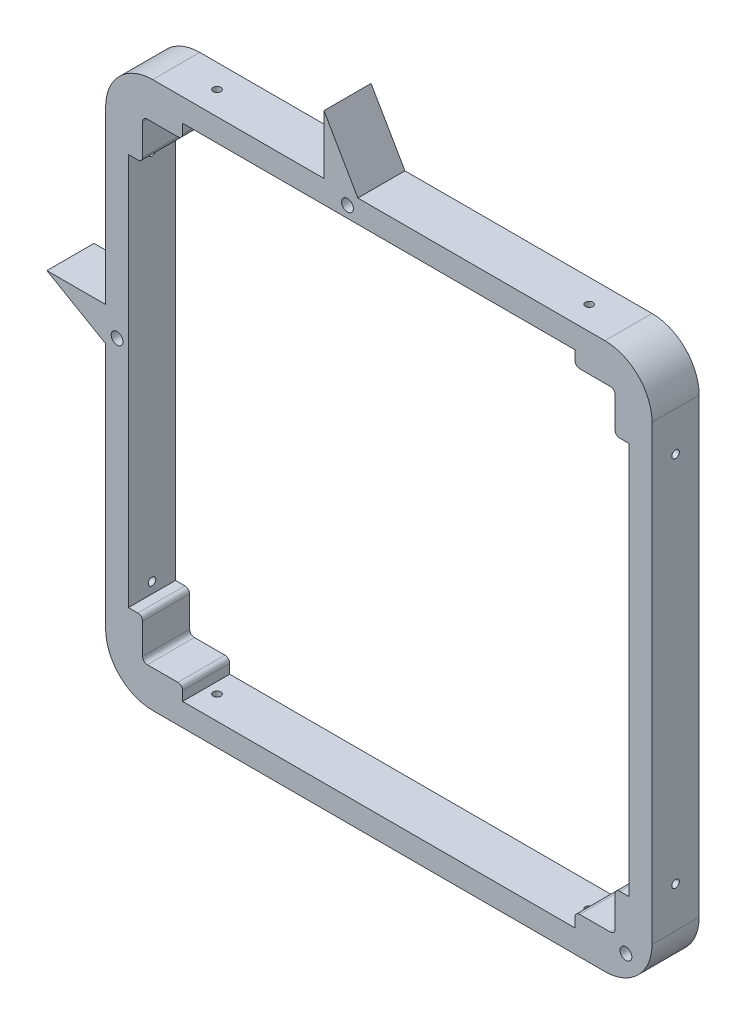
from build123d import *

# Parameters (mm, degrees)
BASE_DEPTH                       = 5
ARM_DEPTH                        = 5
CUT_EXTRUDE1_DEPTH               = 98.51535195125132
BOSS_EXTRUDE4_DEPTH              = 28
CLEARANCE_DEPTH                  = 20
M2X0_4_TAPPED_HOLE1_AT_2_COUNT   = 2
M2X0_4_TAPPED_HOLE1_AT_2_PITCH   = 79
M2X0_4_TAPPED_HOLE2_AT_2_COUNT   = 2
M2X0_4_TAPPED_HOLE2_AT_2_PITCH   = 79
EXTENDER_DEPTH                   = 29
ANGLED_HORIZONTAL_DEPTH          = 10
ARM_START                        = -5
ARM_HOLDER_DEPTH                 = 10
FILLET1_R                        = 1
FILLET2_R                        = 10
M3X0_5_TAPPED_HOLE2_D            = 2.5
BOSS_EXTRUDE18_REACH             = 170.267
SKETCH39_W                       = 4.000000000000028
SKETCH39_H                       = 10.000000000000007
BOSS_EXTRUDE18_DIRECTION_2_REACH = 170.267
SHIM_SUPPORT_ARM_DEPTH           = 6.85
BOSS_EXTRUDE17_REACH             = 169.03
FILLET4_R                        = 2
SPLIT1_START                     = -44
SPLIT1_OUTLINE_R                 = 1.25
SPLIT1_DEPTH                     = 39


# Read off the part's stored shape, not the designer's step: Split1
with BuildPart() as part:
    # Sketch1 → base (new, symmetric)
    with BuildSketch(Plane.XY):
        Polygon((58.00000000000011, 58.00000000000005), (58.00000000000011, -58.00000000000005), (-58.00000000000008, -58.00000000000009), (-58.00000000000008, 58.00000000000009), align=None)
        Polygon((-41.5, 53.00000000000001), (41.5, 53.00000000000001), (41.5, 50.00188016), (50.00188015999998, 50.00188015999996), (50.00188015999998, 41.49999999999998), (52.999999999999986, 41.49999999999998), (52.999999999999986, -41.49999999999998), (50.00188015999996, -41.499999999999964), (50.00188015999999, -50.001880160000006), (41.499999999999964, -50.00188015999996), (41.49999999999998, -52.99999999999998), (-41.5, -53.00000000000001), (-41.5, -50.00188016), (-50.00188015999999, -50.001880160000006), (-50.00188015999996, -41.499999999999964), (-52.999999999999986, -41.49999999999998), (-52.999999999999986, 41.49999999999998), (-50.00188015999998, 41.49999999999998), (-50.00188015999998, 50.00188015999996), (-41.5, 50.00188016), align=None, mode=Mode.SUBTRACT)
    extrude(amount=BASE_DEPTH, both=True)

    # Sketch2 → arm (add, symmetric)
    with BuildSketch(Plane(origin=(0, 0, 0), x_dir=(0.7071067811865476, -0.7071067811865475, 0), z_dir=(0.7071067811865475, 0.7071067811865476, 0))):
        Polygon((70.9254691007821, 5), (82.02438661763962, 5), (82.02438661763962, 44), (32.02438661763962, 43.999999999999986), (32.02438661763962, 33), (70.9254691007821, 33), align=None)
    extrude(amount=ARM_DEPTH, both=True)

    # Sketch3 → Cut-Extrude1 (cut, through all)
    with BuildSketch(Plane.XY):
        Polygon((54.81801948466061, -61.889087296526085), (61.88908729652609, -54.81801948466061), (58.00000000000011, -50.928932188134624), (58.0000000000001, -58.00000000000005), (50.92893218813458, -58.00000000000006), align=None)
    extrude(amount=-CUT_EXTRUDE1_DEPTH, mode=Mode.SUBTRACT)

    # Sketch5 → Boss-Extrude4 (add)
    with BuildSketch(Plane(origin=(0, 0, -5), x_dir=(-1, 0, 0), z_dir=(0, 0, -1))):
        Polygon((-50.15188015999995, -50.151880159999976), (-46.61634625406723, -53.68741406593269), (-43.080812348134494, -50.15188015999998), align=None)
        Polygon((-53.68741406593271, -46.61634625406722), (-50.15188015999995, -50.151880159999976), (-50.15188015999996, -43.08081234813448), align=None)
    extrude(amount=BOSS_EXTRUDE4_DEPTH)

    # Sketch7 → clearance (cut)
    with BuildSketch(Plane.XY.offset(15)):
        Polygon((-41.65, 53.150000000000006), (41.649999999999984, 53.150000000000006), (41.649999999999984, 50.15188016), (50.151880159999976, 50.15188016), (50.151880159999976, 41.64999999999998), (53.149999999999984, 41.64999999999998), (53.14999999999999, -41.64999999999996), (50.15188015999996, -41.64999999999996), (50.15188015999996, -50.15188015999998), (41.64999999999998, -50.15188015999998), (41.64999999999998, -53.14999999999998), (-41.65, -53.149999999999984), (-41.65, -50.15188016), (-50.15188015999999, -50.15188016), (-50.15188015999999, -41.64999999999998), (-53.149999999999984, -41.64999999999998), (-53.149999999999984, 41.64999999999998), (-50.151880159999976, 41.64999999999998), (-50.151880159999976, 50.15188015999996), (-41.65, 50.15188015999996), align=None)
    extrude(amount=-CLEARANCE_DEPTH, mode=Mode.SUBTRACT)

    # Sketch12 → M2x0.4 Tapped Hole1 (revolve, cut)
    with BuildSketch(Plane(origin=(-39.350000000000016, 0, 0), x_dir=(0, 0, -1), z_dir=(1, 0, 0))):
        Polygon((0, 0), (-1.421e-14, 58.00000000000009), (0.7999999999999855, 58.00000000000009), (0.7999999999999883, -1.46e-15), align=None)
    m2x0_4_tapped_hole1 = revolve(axis=Axis((-39.350000000000016, -6.349999999999991, 0), (0, 1, 0)), mode=Mode.SUBTRACT)

    # M2x0.4 Tapped Hole1 at 2: M2x0.4 Tapped Hole1 ×2
    with Locations(*[(i * M2X0_4_TAPPED_HOLE1_AT_2_PITCH, 0, 0) for i in range(1, M2X0_4_TAPPED_HOLE1_AT_2_COUNT)]):
        add(m2x0_4_tapped_hole1, mode=Mode.SUBTRACT)

    # Mirror1: M2x0.4 Tapped Hole1 across plane
    add(m2x0_4_tapped_hole1.mirror(Plane.ZX), mode=Mode.SUBTRACT)

    # Mirror1 copy 1 sketch → Mirror1 copy 1 (revolve, cut)
    with BuildSketch(Plane(origin=(39.649999999999984, 0, 0), x_dir=(0, 0, -1), z_dir=(1, 0, 0))):
        Polygon((0, 0), (-1.421e-14, -58.00000000000009), (0.7999999999999855, -58.00000000000009), (0.7999999999999883, 1.46e-15), align=None)
    revolve(axis=Axis((39.649999999999984, 6.349999999999991, 0), (0, 1, 0)), mode=Mode.SUBTRACT)

    # Sketch15 → M2x0.4 Tapped Hole2 (revolve, cut)
    with BuildSketch(Plane.ZX.offset(39.65)):
        Polygon((0, 0), (-1.421e-14, 58.00000000000011), (0.7999999999999923, 58.00000000000011), (0.7999999999999883, -1.46e-15), align=None)
    m2x0_4_tapped_hole2 = revolve(axis=Axis((-6.349999999999991, 39.65, 0), (1, 0, 0)), mode=Mode.SUBTRACT)

    # M2x0.4 Tapped Hole2 at 2: M2x0.4 Tapped Hole2 ×2
    with Locations(*[(0, -i * M2X0_4_TAPPED_HOLE2_AT_2_PITCH, 0) for i in range(1, M2X0_4_TAPPED_HOLE2_AT_2_COUNT)]):
        add(m2x0_4_tapped_hole2, mode=Mode.SUBTRACT)

    # Mirror2: M2x0.4 Tapped Hole2 across plane
    add(m2x0_4_tapped_hole2.mirror(Plane(origin=(0, 0, 0), x_dir=(0, 0, 1), z_dir=(1, 0, 0))), mode=Mode.SUBTRACT)

    # Mirror2 copy 1 sketch → Mirror2 copy 1 (revolve, cut)
    with BuildSketch(Plane.ZX.offset(-39.35)):
        Polygon((0, 0), (-1.421e-14, -58.00000000000011), (0.7999999999999923, -58.00000000000011), (0.7999999999999883, 1.46e-15), align=None)
    revolve(axis=Axis((6.349999999999991, -39.35, 0), (1, 0, 0)), mode=Mode.SUBTRACT)

    # Sketch16 → extender (add)
    with BuildSketch(Plane(origin=(0, 0, -5), x_dir=(-1, 0, 0), z_dir=(0, 0, -1))):
        Polygon((53.149999999999984, 11.649999999999979), (70.47050807568874, 11.64999999999998), (53.14999999999998, 1.649999999999978), align=None)
    extender = extrude(amount=EXTENDER_DEPTH)

    # Sketch17 → angled horizontal (add)
    with BuildSketch(Plane(origin=(0, 0, -34), x_dir=(-1, 0, 0), z_dir=(0, 0, -1))):
        Polygon((106.18300858899104, 64.68300858899104), (114.84326262683541, 56.02275455114666), (70.47050807568874, 11.64999999999998), (53.14999999999998, 1.649999999999971), (53.149999999999984, 11.649999999999979), align=None)
    angled_horizontal = extrude(amount=ANGLED_HORIZONTAL_DEPTH)

    # Sketch21 → Arm Holder (add)
    with BuildSketch(Plane.XY.offset(ARM_START)):
        Polygon((-53.14999999999998, 1.649999999999971), (-53.14999999999999, 11.649999999999979), (-70.47050807568874, 11.649999999999979), align=None)
        Polygon((-11.649999999999986, 70.47050807568874), (-1.649999999999978, 53.14999999999997), (-11.649999999999986, 53.149999999999984), align=None)
    extrude(amount=ARM_HOLDER_DEPTH)

    # Fillet1
    fillet1_edges = [part.edges().sort_by_distance(p)[0] for p in [
        (50.15188015999996, -50.151880159999976, -14),
        (-41.65, 50.15188015999996, 0),
        (41.649999999999984, 50.15188016, 0),
        (50.151880159999976, 50.15188016, 0),
        (50.151880159999976, 41.64999999999998, 0),
        (50.15188015999996, -41.64999999999996, 0),
        (41.64999999999998, -50.15188015999998, 0),
        (-41.65, -50.15188016, 0),
        (-50.15188015999999, -50.15188016, 0),
        (-50.15188015999999, -41.64999999999998, 0),
        (-50.151880159999976, 41.64999999999998, 0),
        (-50.151880159999976, 50.15188015999996, 0),
    ]]
    fillet(fillet1_edges, radius=FILLET1_R)

    # Fillet2
    fillet2_edges = [part.edges().sort_by_distance(p)[0] for p in [
        (58.00000000000011, -58.00000000000005, -19.5),
        (58.00000000000011, 58.00000000000005, 0),
        (-58.00000000000008, 58.00000000000009, 0),
        (-58.00000000000008, -58.00000000000009, 0),
    ]]
    fillet(fillet2_edges, radius=FILLET2_R)

    # M3x0.5 Tapped Hole2 (through all)
    with Locations(Plane(origin=(-8.64e-15, 8.64e-15, -43.99999999999998), x_dir=(-1, 0, 1e-16), z_dir=(-1e-16, 1e-16, -1))):
        with Locations((-52.465379323, -52.465379323)):
            Hole(M3X0_5_TAPPED_HOLE2_D / 2)

    # Sketch38 → M3x0.5 Tapped Hole3 (revolve, cut)
    with BuildSketch(Plane(origin=(-55.57499999999998, 6.6499999999999755, 5), x_dir=(0, -1, 0), z_dir=(1, 0, 0))):
        Polygon((0, 0), (-7.49e-15, 30.561075773784445), (1.249999999999985, 29.810000000000002), (1.249999999999989, -1.4e-15), align=None)
    m3x0_5_tapped_hole3 = revolve(axis=Axis((-55.57499999999998, 6.6499999999999755, 11.34999999999999), (0, 0, -1)), mode=Mode.SUBTRACT)

    # U part of Outside arm: extender, angled horizontal, M3x0.5 Tapped Hole3 across plane
    add(extender.mirror(Plane(origin=(0, 0, 0), x_dir=(0, 0, 1), z_dir=(0.7071067811865475, 0.7071067811865476, 0))))
    add(angled_horizontal.mirror(Plane(origin=(0, 0, 0), x_dir=(0, 0, 1), z_dir=(0.7071067811865475, 0.7071067811865476, 0))))
    add(m3x0_5_tapped_hole3.mirror(Plane(origin=(0, 0, 0), x_dir=(0, 0, 1), z_dir=(0.7071067811865475, 0.7071067811865476, 0))), mode=Mode.SUBTRACT)

    # Sketch39 → Boss-Extrude18 (add, up to next)
    with BuildSketch(Plane(origin=(0, 0, 0), x_dir=(0.7071067811865476, -0.7071067811865475, 0), z_dir=(0.7071067811865475, 0.7071067811865476, 0)), mode=Mode.PRIVATE) as boss_extrude18_sk1:
        with Locations((-118.82051942088825, 39)):
            Rectangle(SKETCH39_W, SKETCH39_H)
    boss_extrude18_tool1 = extrude(boss_extrude18_sk1.sketch, amount=BOSS_EXTRUDE18_REACH, mode=Mode.PRIVATE) - part.part
    add(boss_extrude18_tool1.solids().sort_by_distance((-84.018795, 84.018795, -39))[0])

    # Sketch39 → Boss-Extrude18 direction 2 (add, up to next)
    with BuildSketch(Plane(origin=(0, 0, 0), x_dir=(0.7071067811865476, -0.7071067811865475, 0), z_dir=(0.7071067811865475, 0.7071067811865476, 0)), mode=Mode.PRIVATE) as boss_extrude18_direction_2_sk1:
        with Locations((-118.82051942088825, 39)):
            Rectangle(SKETCH39_W, SKETCH39_H)
    boss_extrude18_direction_2_tool1 = extrude(boss_extrude18_direction_2_sk1.sketch, amount=-BOSS_EXTRUDE18_DIRECTION_2_REACH, mode=Mode.PRIVATE) - part.part
    add(boss_extrude18_direction_2_tool1.solids().sort_by_distance((-84.018795, 84.018795, -39))[0])

    # Sketch34 → Shim support arm (add)
    with BuildSketch(Plane(origin=(27.06097651600918, -27.060976516009177, 0), x_dir=(0, 0, -1), z_dir=(0.7071067811865476, -0.7071067811865475, 0))):
        Polygon((43.99999999999999, 4.999999999999997), (33, 5.000000000000001), (9.000000000000005, 36.895450840129975), (19.999999999999986, 36.895450840129975), align=None)
    shim_support_arm = extrude(amount=SHIM_SUPPORT_ARM_DEPTH)

    # Boss-Extrude17: up to this face of the body (flat: up to its plane)
    boss_extrude17_end = Plane(part.part.faces().sort_by_distance((44.295095937, -14.670538547, -21))[0])
    # Sketch35 → Boss-Extrude17 (add, up to the picked face)
    with BuildSketch(Plane(origin=(0, 0, -5), x_dir=(-1, 0, 0), z_dir=(0, 0, -1)), mode=Mode.PRIVATE) as boss_extrude17_sk1:
        Polygon((-53.149999999999984, -0.971953032018356), (-57.99368145112784, -5.815634483146219), (-53.149999999999984, -10.659315934274082), align=None)
    boss_extrude17_tool1 = split(extrude(boss_extrude17_sk1.sketch, amount=BOSS_EXTRUDE17_REACH, mode=Mode.PRIVATE), bisect_by=boss_extrude17_end, keep=Keep.BOTH, mode=Mode.PRIVATE)
    boss_extrude17 = boss_extrude17_tool1.solids().sort_by(Axis((54.76456, -5.815634, -5), (0, 0, -1)))[0]
    add(boss_extrude17)

    # Mirror4: Shim support arm, Boss-Extrude17 across plane
    add(shim_support_arm.mirror(Plane(origin=(0, 0, 0), x_dir=(0, 0, 1), z_dir=(0.7071067811865475, 0.7071067811865476, 0))))
    add(boss_extrude17.mirror(Plane(origin=(0, 0, 0), x_dir=(0, 0, 1), z_dir=(0.7071067811865475, 0.7071067811865476, 0))))

    # Fillet4
    fillet4_edges = [part.edges().sort_by_distance(p)[0] for p in [
        (30.596510421941918, -23.52544261007644, -38.5),
        (55.57184072556391, -3.3937937575822943, -19.999999999999986),
        (35.440191873069764, -28.36912406120429, -38.5),
        (53.149999999999984, -5.815634483146219, -11.577170030046497),
        (3.3937937575823067, -55.57184072556391, -19.999999999999986),
        (28.369124061204293, -35.440191873069764, -38.5),
        (23.52544261007645, -30.596510421941908, -38.5),
        (5.815634483146232, -53.149999999999984, -11.577170030046497),
    ]]
    fillet(fillet4_edges, radius=FILLET4_R)

    # Split1 outline → Split1 (cut)
    # profile 1 of 2: a face of its own
    with BuildSketch(Plane.XY.offset(SPLIT1_START)):
        with BuildLine():
            ThreePointArc((50.588190451, -57.659258263), (55.071067812, -55.071067812), (57.659258263, -50.588190451))
            Line((57.659258263, -50.588190451), (36.854405435, -29.783337624))
            ThreePointArc((36.854405435, -29.783337624), (36.268618998, -28.369124062), (36.854405435, -26.954910499))
            Line((36.854405435, -26.954910499), (57.993681451, -5.815634483))
            Line((57.993681451, -5.815634483), (53.15, -0.971953032))
            Line((53.15, -0.971953032), (32.010723984, -22.111229048))
            ThreePointArc((32.010723984, -22.111229048), (30.596510422, -22.697015485), (29.18229686, -22.111229048))
            Line((29.18229686, -22.111229048), (26.180194847, -19.109127035))
            Line((26.180194847, -19.109127035), (19.109127035, -26.180194847))
            Line((19.109127035, -26.180194847), (22.111229048, -29.18229686))
            ThreePointArc((22.111229048, -29.18229686), (22.697015485, -30.596510422), (22.111229048, -32.010723984))
            Line((22.111229048, -32.010723984), (0.971953032, -53.15))
            Line((0.971953032, -53.15), (5.815634483, -57.993681451))
            Line((5.815634483, -57.993681451), (26.954910499, -36.854405435))
            ThreePointArc((26.954910499, -36.854405435), (28.369124062, -36.268618998), (29.783337624, -36.854405435))
            Line((29.783337624, -36.854405435), (50.588190451, -57.659258263))
        make_face()
        with Locations((52.465379323, -52.465379323)):
            Circle(SPLIT1_OUTLINE_R, mode=Mode.SUBTRACT)
    # profile 2 of 2: a face of its own
    with BuildSketch(Plane.XY.offset(SPLIT1_START)):
        Polygon((-11.65, 53.15), (-1.65, 53.15), (-11.65, 70.470508076), (-56.022754551, 114.843262627), (-114.843262627, 56.022754551), (-70.470508076, 11.65), (-53.15, 1.65), (-53.15, 11.65), (-103.354581464, 61.854581464), (-61.854581464, 103.354581464), align=None)
    extrude(amount=SPLIT1_DEPTH, mode=Mode.SUBTRACT)


solid = part.part
